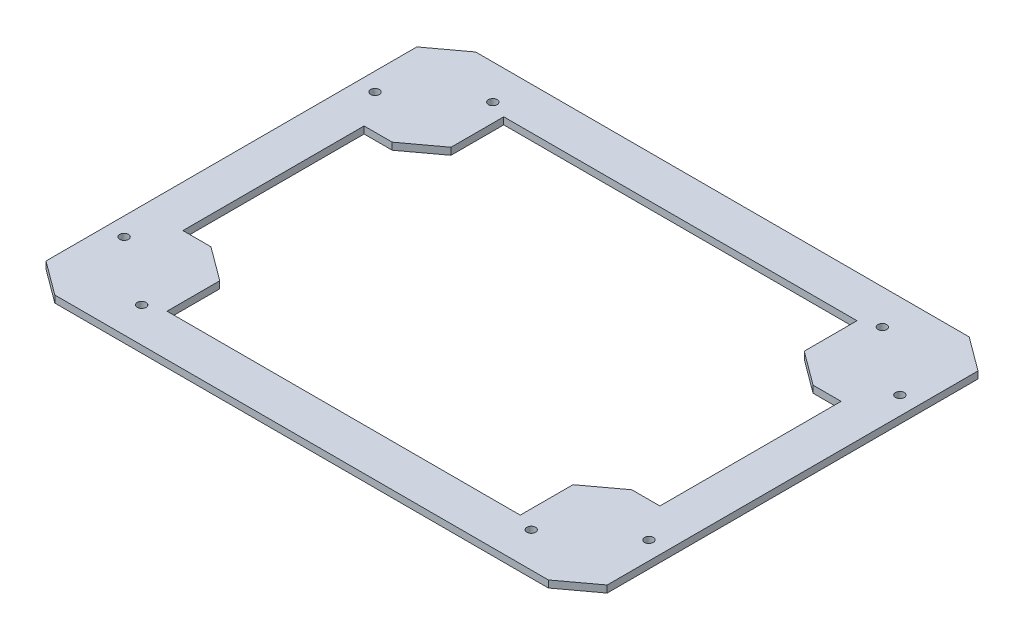
from build123d import *

# Parameters (mm, degrees)
BOSS_EXTRUDE1_DEPTH = 3.175
SKETCH2_R           = 1.984375
CUT_EXTRUDE1_DEPTH  = 159.781746826


with BuildPart() as part:
    # Sketch1 → Boss-Extrude1 (new body)
    with BuildSketch(Plane(origin=(0, 0, 0), x_dir=(1, 0, 0), z_dir=(0, 1, 0))):
        Polygon((-111.686526805, 95.25), (-127, 83.918625912), (-127, -83.918625912), (-111.686526805, -95.25), (111.686526805, -95.25), (127, -83.918625912), (127, 83.918625912), (111.686526805, 95.25), align=None)
        Polygon((-107.95, -41.010963508), (-107.95, 41.010963508), (-95.25, 41.010963508), (-79.936526805, 52.342337595), (-79.936526805, 76.2), (38.831798823, 76.2), (79.936526805, 76.2), (79.936526805, 52.342337595), (95.25, 41.010963508), (107.95, 41.010963508), (107.95, -41.010963508), (95.25, -41.010963508), (79.936526805, -52.342337595), (79.936526805, -76.2), (38.1, -76.2), (-79.936526805, -76.2), (-79.936526805, -52.342337595), (-95.25, -41.010963508), align=None, mode=Mode.SUBTRACT)
    extrude(amount=BOSS_EXTRUDE1_DEPTH)

    # Sketch2 → Cut-Extrude1 (cut, through all)
    with BuildSketch(Plane(origin=(0, 3.175, 0), x_dir=(1, 0, 0), z_dir=(0, 1, 0))):
        with Locations((-88.154790208, 79.461855841)):
            Circle(SKETCH2_R)
        with Locations((88.154790208, 79.461855841)):
            Circle(SKETCH2_R)
        with Locations((88.154790208, -79.461855841)):
            Circle(SKETCH2_R)
        with Locations((-88.154790208, -79.461855841)):
            Circle(SKETCH2_R)
        with Locations((-118.781736597, 56.799107666)):
            Circle(SKETCH2_R)
        with Locations((118.781736597, 56.799107666)):
            Circle(SKETCH2_R)
        with Locations((-118.781736597, -56.799107666)):
            Circle(SKETCH2_R)
        with Locations((118.781736597, -56.799107666)):
            Circle(SKETCH2_R)
    extrude(amount=-CUT_EXTRUDE1_DEPTH, mode=Mode.SUBTRACT)


solid = part.part
